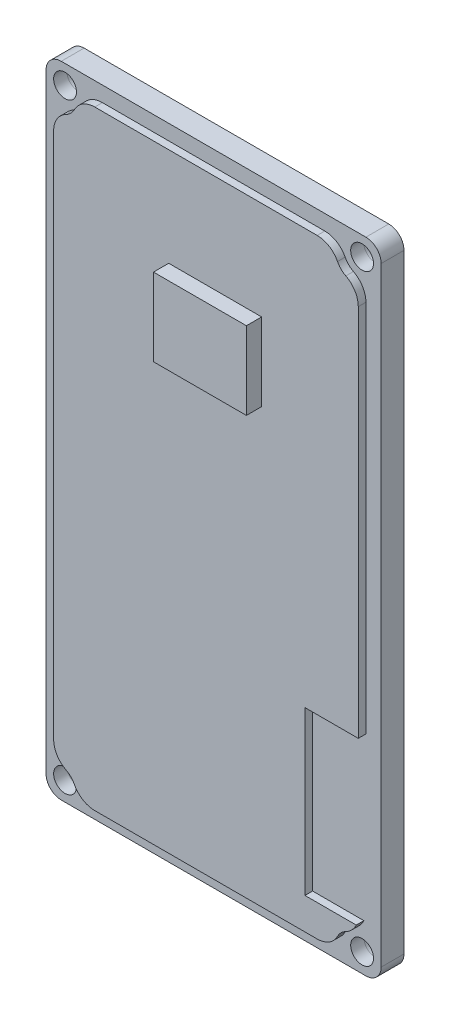
from build123d import *

# Parameters (mm, degrees)
BASESKETCH_R        = 1.5
BASE_DEPTH          = 3
REVERSESKIRT_DEPTH  = 1
BOSS_EXTRUDE3_START = 1
BASESKETCH_7_W      = 12.2
BASESKETCH_7_H      = 10.199864801
BOSS_EXTRUDE3_DEPTH = 2
TEXT_2_W            = 2.116666667
TEXT_2_H            = 4.396153846
CUT_EXTRUDE1_DEPTH  = 0.1
FILLET1_SIZE        = 0.254
FILLET1_SIZE_2      = 1.27


with BuildPart() as part:
    # baseSketch → base (new body)
    with BuildSketch(Plane.XY):
        with BuildLine():
            Line((-1.501668235, 82), (38.498331765, 82))
            ThreePointArc((38.498331765, 82), (39.912545328, 81.414213562), (40.498331765, 80))
            Line((40.498331765, 80), (40.498331765, 0))
            ThreePointArc((40.498331765, 0), (39.912545328, -1.414213562), (38.498331765, -2))
            Line((38.498331765, -2), (-1.501668235, -2))
            ThreePointArc((-1.501668235, -2), (-2.915881797, -1.414213562), (-3.501668235, 0))
            Line((-3.501668235, 0), (-3.501668235, 80))
            ThreePointArc((-3.501668235, 80), (-2.915881797, 81.414213562), (-1.501668235, 82))
        make_face()
        with Locations((-1.001668235, 0.5)):
            Circle(BASESKETCH_R, mode=Mode.SUBTRACT)
        with Locations((37.998331765, 0.5)):
            Circle(BASESKETCH_R, mode=Mode.SUBTRACT)
        with Locations((37.998331765, 79.5)):
            Circle(BASESKETCH_R, mode=Mode.SUBTRACT)
        with Locations((-1.001668235, 79.5)):
            Circle(BASESKETCH_R, mode=Mode.SUBTRACT)
    extrude(amount=-BASE_DEPTH)

    # baseSketch<6> → reverseSkirt (add)
    with BuildSketch(Plane.XY):
        with BuildLine():
            Line((33.09935228, 80), (3.897311251, 80))
            ThreePointArc((3.897311251, 80), (2.330612347, 79.558408596), (1.225140622, 78.363636364))
            ThreePointArc((1.225140622, 78.363636364), (0.766098718, 77.732233047), (0.134695402, 77.273191143))
            ThreePointArc((0.134695402, 77.273191143), (-1.060076831, 76.167719418), (-1.501668235, 74.601020514))
            Line((-1.501668235, 74.601020514), (-1.501668235, 5.398979486))
            ThreePointArc((-1.501668235, 5.398979486), (-1.060076831, 3.832280582), (0.134695402, 2.726808857))
            ThreePointArc((0.134695402, 2.726808857), (0.766098718, 2.267766953), (1.225140622, 1.636363636))
            ThreePointArc((1.225140622, 1.636363636), (2.330612347, 0.441591404), (3.897311251, 0))
            Line((3.897311251, 0), (33.09935228, 0))
            ThreePointArc((33.09935228, 0), (34.666051183, 0.441591404), (35.771522908, 1.636363636))
            ThreePointArc((35.771522908, 1.636363636), (36.230564812, 2.267766953), (36.861968129, 2.726808857))
            ThreePointArc((36.861968129, 2.726808857), (37.664536763, 3.323514259), (38.226374133, 4.150866975))
            Line((38.226374133, 4.150866975), (31.498331765, 4.150866975))
            Line((31.498331765, 4.150866975), (31.498331765, 25.512826935))
            Line((31.498331765, 25.512826935), (38.498331765, 25.512826935))
            Line((38.498331765, 25.512826935), (38.498331765, 74.601020514))
            ThreePointArc((38.498331765, 74.601020514), (38.056740362, 76.167719418), (36.861968129, 77.273191143))
            ThreePointArc((36.861968129, 77.273191143), (36.230564812, 77.732233047), (35.771522908, 78.363636364))
            ThreePointArc((35.771522908, 78.363636364), (34.666051183, 79.558408596), (33.09935228, 80))
        make_face()
    extrude(amount=REVERSESKIRT_DEPTH)

    # baseSketch<7> → Boss-Extrude3 (add)
    with BuildSketch(Plane.XY.offset(BOSS_EXTRUDE3_START)):
        with Locations((19.708331765, 61.985983146)):
            Rectangle(BASESKETCH_7_W, BASESKETCH_7_H)
    extrude(amount=BOSS_EXTRUDE3_DEPTH)

    # TEXT 2 → Cut-Extrude1 (cut)
    # profile 1 of 5: a face of its own
    with BuildSketch(Plane(origin=(0, 0, -3), x_dir=(-1, 0, 0), z_dir=(0, 0, -1))):
        with BuildLine():
            Line((-28.995166701, 69.796153846), (-27.397490419, 68.124699519))
            add(Edge.make_bspline(
                [(-27.397490419, 68.124699519), (-27.544123171, 67.982926351), (-27.830542873, 67.705998939), (-28.209317791, 67.259539174), (-28.52630191, 66.796423439), (-28.787908223, 66.32127296), (-28.993814832, 65.833157801), (-29.139413406, 65.330440941), (-29.229168764, 64.813856933), (-29.239359796, 64.464139608), (-29.244485612, 64.288241186)],
                knots=[0, 0, 0, 0, 1.115315123, 2.178559852, 3.196385012, 4.180486591, 5.141138664, 6.08807191, 7.038351522, 8, 8, 8, 8], degree=3))
            add(Edge.make_bspline(
                [(-29.244485612, 64.288241186), (-29.240424068, 64.141350187), (-29.232409059, 63.851476984), (-29.173509547, 63.425907377), (-29.073726161, 63.01867371), (-28.93502798, 62.629452891), (-28.760360462, 62.256320571), (-28.540815986, 61.902751274), (-28.283722113, 61.566844883), (-27.989528727, 61.252526184), (-27.665722403, 60.96876439), (-27.324696298, 60.713090982), (-26.960418487, 60.501318474), (-26.578201255, 60.328448816), (-26.177906583, 60.19222355), (-25.759554508, 60.095539013), (-25.322200465, 60.039519928), (-25.024879653, 60.031167849), (-24.873772471, 60.026923077)],
                knots=[0, 0, 0, 0, 1.035268443, 2.04298821, 3.02163646, 3.985902049, 4.951223231, 5.920091634, 6.913651787, 7.92868536, 8.949353712, 9.945284791, 10.92850487, 11.913014323, 12.897904816, 13.904240668, 14.934873455, 16, 16, 16, 16], degree=3))
            add(Edge.make_bspline(
                [(-24.873772471, 60.026923077), (-24.767718526, 60.028165395), (-24.558684024, 60.03061403), (-24.250249175, 60.056687234), (-23.950383133, 60.100107787), (-23.65980659, 60.160592915), (-23.378140132, 60.238129836), (-23.104724207, 60.327698343), (-22.84281875, 60.442100191), (-22.58751992, 60.567940714), (-22.344973285, 60.712716287), (-22.115019157, 60.871245981), (-21.897606066, 61.04206879), (-21.693507056, 61.227466073), (-21.505660271, 61.429772383), (-21.328950902, 61.644101715), (-21.166166353, 61.872583266), (-21.019898853, 62.115308609), (-20.883562036, 62.36493261), (-20.770662036, 62.626597822), (-20.669170392, 62.892984981), (-20.592818436, 63.168769386), (-20.526408286, 63.449092581), (-20.48584956, 63.737856549), (-20.455030286, 64.032320772), (-20.453132801, 64.231337924), (-20.452177919, 64.331490385)],
                knots=[0, 0, 0, 0, 1.103738238, 2.175490744, 3.219137561, 4.256155604, 5.262629953, 6.259184223, 7.247888397, 8.234817694, 9.220364322, 10.185094651, 11.140491148, 12.096499151, 13.05201798, 14.011605636, 14.986460005, 15.968997565, 16.960259839, 17.944382265, 18.933125845, 19.924977513, 20.920749559, 21.929466621, 22.958034467, 24, 24, 24, 24], degree=3))
            add(Edge.make_bspline(
                [(-20.452177919, 64.331490385), (-20.457073047, 64.50137174), (-20.466690699, 64.835144428), (-20.542448518, 65.324887019), (-20.665739365, 65.792315293), (-20.815538924, 66.16443902), (-20.960790839, 66.456155019), (-21.091365823, 66.680096629), (-21.241897985, 66.909212928), (-21.413012402, 67.143154987), (-21.603961383, 67.38328065), (-21.818476008, 67.625616162), (-22.04962254, 67.876287702), (-22.21459082, 68.040503195), (-22.299173112, 68.124699519)],
                knots=[0, 0, 0, 0, 1.404693586, 2.759857621, 4.088769373, 5.395275838, 6.0697462, 6.783214465, 7.53810233, 8.336454657, 9.18000028, 10.074808326, 11.012918585, 12, 12, 12, 12], degree=3))
            Line((-22.299173112, 68.124699519), (-20.597189938, 69.745272436))
            add(Edge.make_bspline(
                [(-20.597189938, 69.745272436), (-20.487206117, 69.631354883), (-20.272541219, 69.409012181), (-19.967737095, 69.073614388), (-19.693836705, 68.738638706), (-19.440898667, 68.41217745), (-19.21629168, 68.088882845), (-19.019791425, 67.768789174), (-18.846428127, 67.455520039), (-18.699125474, 67.142570305), (-18.574050222, 66.827992638), (-18.46636864, 66.504329186), (-18.375273896, 66.17059048), (-18.3017724, 65.824738196), (-18.242834124, 65.469998234), (-18.203051128, 65.103050699), (-18.176306344, 64.726222219), (-18.173903103, 64.470613623), (-18.17269074, 64.341666667)],
                knots=[0, 0, 0, 0, 1.244526981, 2.429050516, 3.560637417, 4.644440555, 5.67424972, 6.652764056, 7.595344123, 8.486817594, 9.369275933, 10.254498637, 11.166417451, 12.086725134, 13.032340136, 13.991389299, 14.986715468, 16, 16, 16, 16], degree=3))
            add(Edge.make_bspline(
                [(-18.17269074, 64.341666667), (-18.178728763, 64.10480708), (-18.190543496, 63.641338709), (-18.278082669, 62.962137895), (-18.42484055, 62.316915354), (-18.632396673, 61.70410138), (-18.897539892, 61.123890834), (-19.222593029, 60.57643215), (-19.606692469, 60.062607712), (-20.045336193, 59.586568209), (-20.529781362, 59.155967823), (-21.049942571, 58.775366947), (-21.608376222, 58.460533889), (-22.196832464, 58.199121216), (-22.817996654, 57.994699944), (-23.472540702, 57.850822024), (-24.159832604, 57.762093561), (-24.629268816, 57.752386541), (-24.868684329, 57.747435897)],
                knots=[0, 0, 0, 0, 1.078019885, 2.10938526, 3.111377082, 4.085535484, 5.04941344, 6.010039228, 6.978205633, 7.964457913, 8.951525778, 9.924444315, 10.892603023, 11.863865945, 12.85144698, 13.863884204, 14.910567087, 16, 16, 16, 16], degree=3))
            add(Edge.make_bspline(
                [(-24.868684329, 57.747435897), (-25.024832834, 57.749507179), (-25.334281005, 57.753611954), (-25.790894007, 57.797562387), (-26.235452271, 57.857258706), (-26.664156886, 57.955322006), (-27.081887637, 58.06932493), (-27.48494785, 58.216200785), (-27.875035367, 58.386841437), (-28.251657513, 58.581681383), (-28.610747266, 58.804841236), (-28.954594665, 59.047803005), (-29.278745529, 59.316459147), (-29.584536295, 59.60809052), (-29.875430567, 59.92000221), (-30.144274291, 60.257536113), (-30.398279908, 60.614935717), (-30.629871978, 60.994676792), (-30.840500982, 61.38810619), (-31.021710725, 61.79331219), (-31.177195323, 62.205071055), (-31.305206365, 62.624631294), (-31.401018497, 63.052734784), (-31.473474678, 63.486512958), (-31.513993445, 63.929606525), (-31.520625151, 64.227107272), (-31.523972791, 64.377283654)],
                knots=[0, 0, 0, 0, 1.071814294, 2.12407397, 3.147667899, 4.14936388, 5.141177959, 6.119239245, 7.091825145, 8.063277363, 9.028022524, 9.992609517, 10.952139039, 11.915934802, 12.892469547, 13.878248468, 14.87668965, 15.901326483, 16.93027266, 17.938917451, 18.9468897, 19.950817235, 20.948103127, 21.957084021, 22.968749718, 24, 24, 24, 24], degree=3))
            add(Edge.make_bspline(
                [(-31.523972791, 64.377283654), (-31.522051851, 64.505398785), (-31.518229942, 64.760297006), (-31.486426488, 65.139893695), (-31.436337673, 65.516412991), (-31.361292412, 65.888705125), (-31.270409147, 66.258444275), (-31.158465498, 66.624082439), (-31.021920484, 66.98461136), (-30.870872882, 67.343156538), (-30.69891303, 67.692567325), (-30.506437672, 68.029807102), (-30.298482145, 68.355711491), (-30.071469584, 68.66831583), (-29.828734506, 68.969821925), (-29.570284947, 69.259908075), (-29.291432697, 69.535790683), (-29.094421282, 69.708927377), (-28.995166701, 69.796153846)],
                knots=[0, 0, 0, 0, 0.996333415, 1.982307736, 2.96084097, 3.949129141, 4.93457382, 5.921430247, 6.92116383, 7.931890485, 8.946633814, 9.948019707, 10.950686436, 11.952094051, 12.951305284, 13.960287133, 14.972390273, 16, 16, 16, 16], degree=3))
        make_face()
    # profile 2 of 5: a face of its own
    with BuildSketch(Plane(origin=(0, 0, -3), x_dir=(-1, 0, 0), z_dir=(0, 0, -1))):
        with Locations((-23.138716381, 48.38525641)):
            Rectangle(TEXT_2_W, TEXT_2_H)
    # profile 3 of 5: a face of its own
    with BuildSketch(Plane(origin=(0, 0, -3), x_dir=(-1, 0, 0), z_dir=(0, 0, -1))):
        with BuildLine():
            Line((-29.501436733, 38.697435897), (-27.941921509, 36.992908654))
            add(Edge.make_bspline(
                [(-27.941921509, 36.992908654), (-28.044916247, 36.919894016), (-28.242651781, 36.779716092), (-28.507424321, 36.5525023), (-28.733295002, 36.326314494), (-28.91932024, 36.099057182), (-29.064369794, 35.868716043), (-29.167066481, 35.635690914), (-29.232351739, 35.40130288), (-29.240481324, 35.243830302), (-29.244485612, 35.166266026)],
                knots=[0, 0, 0, 0, 1.299362458, 2.494594718, 3.587462134, 4.587049575, 5.512617175, 6.380583204, 7.202344345, 8, 8, 8, 8], degree=3))
            add(Edge.make_bspline(
                [(-29.244485612, 35.166266026), (-29.242023752, 35.093880583), (-29.237270549, 34.954123311), (-29.187646557, 34.755816969), (-29.107456856, 34.577605219), (-28.996687579, 34.424235141), (-28.864396918, 34.300852249), (-28.723567053, 34.204914682), (-28.570016129, 34.149165174), (-28.464708217, 34.142005836), (-28.412574554, 34.138461538)],
                knots=[0, 0, 0, 0, 1.184157716, 2.286297433, 3.324836695, 4.370048774, 5.362957217, 6.276446515, 7.146738784, 8, 8, 8, 8], degree=3))
            add(Edge.make_bspline(
                [(-28.412574554, 34.138461538), (-28.35971357, 34.140705074), (-28.253258896, 34.145223242), (-28.097236313, 34.188862597), (-27.944784086, 34.254639565), (-27.851979162, 34.317492144), (-27.804541701, 34.349619391)],
                knots=[0, 0, 0, 0, 0.967525499, 1.948461899, 2.951351359, 4, 4, 4, 4], degree=3))
            add(Edge.make_bspline(
                [(-27.804541701, 34.349619391), (-27.767774299, 34.378940023), (-27.682651567, 34.446822225), (-27.545798515, 34.572445063), (-27.384041359, 34.736478507), (-27.194019144, 34.934846153), (-26.973927719, 35.166856004), (-26.727443534, 35.436105012), (-26.456963851, 35.744560419), (-26.266277043, 35.960909121), (-26.166160291, 36.074499199)],
                knots=[0, 0, 0, 0, 0.473854981, 1.097054127, 1.870604305, 2.795416232, 3.865517794, 5.093525133, 6.47400653, 8, 8, 8, 8], degree=3))
            add(Edge.make_bspline(
                [(-26.166160291, 36.074499199), (-26.073730002, 36.181354138), (-25.898316517, 36.384142613), (-25.648935813, 36.672304664), (-25.425581046, 36.927199975), (-25.226579666, 37.146510374), (-25.060126805, 37.336789372), (-24.915982054, 37.489621371), (-24.80045112, 37.611547259), (-24.730590406, 37.680786877), (-24.700775676, 37.710336538)],
                knots=[0, 0, 0, 0, 1.543627419, 2.929484142, 4.163674036, 5.24627963, 6.164986907, 6.925413438, 7.541394495, 8, 8, 8, 8], degree=3))
            add(Edge.make_bspline(
                [(-24.700775676, 37.710336538), (-24.5794307, 37.822446946), (-24.346163043, 38.03796252), (-23.984763056, 38.318228386), (-23.632274262, 38.547881695), (-23.282936132, 38.727617493), (-22.928682814, 38.862112978), (-22.5618743, 38.956338508), (-22.179725527, 39.013628705), (-21.9194567, 39.019903291), (-21.787814938, 39.023076923)],
                knots=[0, 0, 0, 0, 1.206593015, 2.319495511, 3.336910718, 4.276265636, 5.184178927, 6.099356736, 7.038670786, 8, 8, 8, 8], degree=3))
            add(Edge.make_bspline(
                [(-21.787814938, 39.023076923), (-21.659550667, 39.020803604), (-21.407891393, 39.016343267), (-21.03962552, 38.961712705), (-20.687179139, 38.883812712), (-20.354387168, 38.763365726), (-20.035787653, 38.616565411), (-19.736340667, 38.432530926), (-19.453025901, 38.216404268), (-19.190869033, 37.968702866), (-18.953094274, 37.694667331), (-18.740999694, 37.400916022), (-18.567279882, 37.083451331), (-18.418503688, 36.748596144), (-18.312631792, 36.390236939), (-18.229339059, 36.014905024), (-18.180541063, 35.618699233), (-18.175345217, 35.347875089), (-18.17269074, 35.209515224)],
                knots=[0, 0, 0, 0, 1.043169307, 2.046737005, 3.02462096, 3.976528701, 4.921503154, 5.875710796, 6.831116189, 7.817539083, 8.805892356, 9.780872653, 10.7604363, 11.74661763, 12.757588865, 13.796088471, 14.874055702, 16, 16, 16, 16], degree=3))
            add(Edge.make_bspline(
                [(-18.17269074, 35.209515224), (-18.174616267, 35.100896041), (-18.178429915, 34.885767764), (-18.209609286, 34.568711496), (-18.259820027, 34.262518409), (-18.332169208, 33.967716621), (-18.422590003, 33.681999688), (-18.538020608, 33.408152723), (-18.670719273, 33.144207705), (-18.8235373, 32.890707203), (-19.00112398, 32.649249781), (-19.196527402, 32.413068688), (-19.419213853, 32.189943683), (-19.664859877, 31.974874375), (-19.934972033, 31.770636082), (-20.22545156, 31.570255796), (-20.541785568, 31.382719584), (-20.76369254, 31.266867156), (-20.877037695, 31.207692308)],
                knots=[0, 0, 0, 0, 1.016956594, 2.014157282, 2.980233409, 3.920138626, 4.854357287, 5.783465618, 6.699725051, 7.61900777, 8.551402113, 9.504102091, 10.486778735, 11.499758944, 12.559144124, 13.656050795, 14.802762778, 16, 16, 16, 16], degree=3))
            Line((-20.877037695, 31.207692308), (-22.080383047, 33.212419872))
            add(Edge.make_bspline(
                [(-22.080383047, 33.212419872), (-21.951721112, 33.286438413), (-21.705065185, 33.428338283), (-21.373651685, 33.668800879), (-21.089850882, 33.915142532), (-20.858678972, 34.173058441), (-20.67704489, 34.439412445), (-20.547236574, 34.715491096), (-20.466885373, 35.001488361), (-20.457072636, 35.196296705), (-20.452177919, 35.293469551)],
                knots=[0, 0, 0, 0, 1.283663364, 2.460892379, 3.537111102, 4.529833553, 5.449777664, 6.316464042, 7.160231139, 8, 8, 8, 8], degree=3))
            add(Edge.make_bspline(
                [(-20.452177919, 35.293469551), (-20.45617521, 35.392308248), (-20.463930537, 35.584069715), (-20.535564151, 35.85778467), (-20.64803418, 36.108736905), (-20.808513401, 36.325658164), (-20.993730815, 36.509333409), (-21.199793656, 36.644896282), (-21.422748675, 36.730057794), (-21.577627898, 36.73906143), (-21.655523272, 36.743589744)],
                knots=[0, 0, 0, 0, 1.13588714, 2.203786484, 3.234766741, 4.283437687, 5.291419208, 6.222934724, 7.106237994, 8, 8, 8, 8], degree=3))
            add(Edge.make_bspline(
                [(-21.655523272, 36.743589744), (-21.727992242, 36.739408032), (-21.875206016, 36.730913284), (-22.094089226, 36.668343592), (-22.312872892, 36.57052808), (-22.492325174, 36.45480543), (-22.642575706, 36.337043144), (-22.772760995, 36.224435837), (-22.916592948, 36.087309925), (-23.074252494, 35.9260131), (-23.247127552, 35.742676513), (-23.435201191, 35.537145726), (-23.636816709, 35.307067195), (-23.774155207, 35.144447235), (-23.845967983, 35.059415064)],
                knots=[0, 0, 0, 0, 0.916159276, 1.861089862, 2.860218735, 3.940849679, 4.552606315, 5.27541173, 6.11797699, 7.06649574, 8.129236253, 9.306560635, 10.591630461, 12, 12, 12, 12], degree=3))
            add(Edge.make_bspline(
                [(-23.845967983, 35.059415064), (-23.982738901, 34.897765386), (-24.245243689, 34.587510727), (-24.632956534, 34.149083684), (-24.995304311, 33.754014094), (-25.336789865, 33.405747164), (-25.651031859, 33.099739099), (-25.940820009, 32.838396453), (-26.208195277, 32.623119805), (-26.527006339, 32.399664119), (-26.912045115, 32.184777129), (-27.374997987, 31.998705087), (-27.838358202, 31.879119581), (-28.149860414, 31.865619165), (-28.303179522, 31.858974359)],
                knots=[0, 0, 0, 0, 1.345561566, 2.582539916, 3.71901348, 4.751744315, 5.681651107, 6.506005906, 7.230637833, 7.861516384, 8.978504332, 10.023243174, 11.027054763, 12, 12, 12, 12], degree=3))
            add(Edge.make_bspline(
                [(-28.303179522, 31.858974359), (-28.41191006, 31.861729204), (-28.6261209, 31.867156543), (-28.941087569, 31.915567553), (-29.245000672, 31.987923627), (-29.536766838, 32.092990852), (-29.815963035, 32.229408173), (-30.084174882, 32.394884072), (-30.338586773, 32.593292896), (-30.581701258, 32.814044101), (-30.801596457, 33.060195987), (-30.995576073, 33.322140731), (-31.160298409, 33.598729502), (-31.292525891, 33.891027973), (-31.397488362, 34.196648698), (-31.471018781, 34.516363798), (-31.514981977, 34.849572647), (-31.520938515, 35.076241194), (-31.523972791, 35.191706731)],
                knots=[0, 0, 0, 0, 1.010608097, 1.99100651, 2.956992389, 3.912457524, 4.868345712, 5.842283282, 6.837666818, 7.864758285, 8.892394644, 9.901925088, 10.892014243, 11.880216914, 12.880338321, 13.892361018, 14.926363314, 16, 16, 16, 16], degree=3))
            add(Edge.make_bspline(
                [(-31.523972791, 35.191706731), (-31.518498975, 35.341341452), (-31.50759455, 35.63942973), (-31.422321366, 36.080159733), (-31.288231283, 36.510654879), (-31.126431971, 36.857528734), (-30.969775192, 37.133594155), (-30.825312572, 37.344977197), (-30.660453045, 37.561328012), (-30.470550141, 37.779297757), (-30.261832768, 38.004177603), (-30.029489826, 38.23264519), (-29.775911505, 38.46713422), (-29.594531114, 38.619323829), (-29.501436733, 38.697435897)],
                knots=[0, 0, 0, 0, 1.282949271, 2.555771389, 3.837399776, 5.142782039, 5.830402679, 6.558840402, 7.337330299, 8.162747002, 9.037840561, 9.968992266, 10.957575255, 12, 12, 12, 12], degree=3))
        make_face()
    # profile 4 of 5: a face of its own
    with BuildSketch(Plane(origin=(0, 0, -3), x_dir=(-1, 0, 0), z_dir=(0, 0, -1))):
        with BuildLine():
            Line((-31.198331765, 21.926923077), (-31.198331765, 24.582932692))
            add(Edge.make_bspline(
                [(-31.198331765, 24.582932692), (-31.197717808, 24.758495419), (-31.196536996, 25.096151996), (-31.177506599, 25.58301353), (-31.15160169, 26.030336371), (-31.110125926, 26.438343245), (-31.06122899, 26.808025171), (-30.997491071, 27.138197357), (-30.926191781, 27.429899711), (-30.836989455, 27.685236395), (-30.736529992, 27.915741237), (-30.620759687, 28.130357906), (-30.492175307, 28.335423364), (-30.342452162, 28.524329103), (-30.184949366, 28.708119343), (-30.009044742, 28.877746251), (-29.817793881, 29.036124246), (-29.611234993, 29.180394128), (-29.393733565, 29.313063388), (-29.164502916, 29.427185599), (-28.925407662, 29.524486336), (-28.677626512, 29.606243166), (-28.418687919, 29.667201276), (-28.151544756, 29.70894195), (-27.874785593, 29.739653292), (-27.686755804, 29.741411044), (-27.590839778, 29.742307692)],
                knots=[0, 0, 0, 0, 1.748890285, 3.363608654, 4.853419723, 6.211897754, 7.448506646, 8.566916444, 9.560702549, 10.437053547, 11.257979428, 12.063058964, 12.86458444, 13.665575447, 14.461919362, 15.274455744, 16.096554533, 16.933325211, 17.78237398, 18.632472903, 19.481227396, 20.352186419, 21.229229428, 22.127857616, 23.044999956, 24, 24, 24, 24], degree=3))
            add(Edge.make_bspline(
                [(-27.590839778, 29.742307692), (-27.490728786, 29.739962704), (-27.294429375, 29.735364609), (-27.006043658, 29.710802107), (-26.729467408, 29.665137527), (-26.466475531, 29.598225766), (-26.21437453, 29.518136318), (-25.977099055, 29.414412763), (-25.750451732, 29.296463116), (-25.538167499, 29.156536577), (-25.335684302, 29.002877327), (-25.150356255, 28.82442032), (-24.973398058, 28.63124909), (-24.81083576, 28.417485311), (-24.663681339, 28.183768973), (-24.525957595, 27.934494877), (-24.400110733, 27.666218058), (-24.329720177, 27.477774884), (-24.293724394, 27.381410256)],
                knots=[0, 0, 0, 0, 1.099808295, 2.156523617, 3.176426857, 4.17500812, 5.135317955, 6.078349783, 7.015890908, 7.9382699, 8.868004242, 9.803692517, 10.759882289, 11.743580734, 12.748787378, 13.791075452, 14.870417076, 16, 16, 16, 16], degree=3))
            Line((-24.293724394, 27.381410256), (-18.498331765, 30.312179487))
            Line((-18.498331765, 30.312179487), (-18.498331765, 27.778285256))
            Line((-18.498331765, 27.778285256), (-24.034229201, 24.979807692))
            Line((-24.034229201, 24.979807692), (-24.034229201, 24.206410256))
            Line((-24.034229201, 24.206410256), (-18.498331765, 24.206410256))
            Line((-18.498331765, 24.206410256), (-18.498331765, 21.926923077))
            Line((-18.498331765, 21.926923077), (-31.198331765, 21.926923077))
        make_face()
        with BuildLine():
            Line((-26.313716381, 24.206410256), (-26.313716381, 25.094290865))
            add(Edge.make_bspline(
                [(-26.313716381, 25.094290865), (-26.314938953, 25.20284165), (-26.317279915, 25.410693079), (-26.32813827, 25.709610733), (-26.354301538, 25.98109925), (-26.38735785, 26.226324495), (-26.425526136, 26.446520418), (-26.480223607, 26.63972295), (-26.538833332, 26.808909046), (-26.611670016, 26.952073846), (-26.694501124, 27.07439056), (-26.788599322, 27.180003215), (-26.897506004, 27.267360023), (-27.018261557, 27.339259132), (-27.151934033, 27.395188822), (-27.297056012, 27.436013211), (-27.45528062, 27.458828007), (-27.564477144, 27.461452927), (-27.621368624, 27.462820513)],
                knots=[0, 0, 0, 0, 1.688639943, 3.233382647, 4.650958383, 5.928841754, 7.082724185, 8.122798841, 9.049171256, 9.863274652, 10.613301712, 11.341792392, 12.054588806, 12.776240173, 13.521029143, 14.301969904, 15.115324896, 16, 16, 16, 16], degree=3))
            add(Edge.make_bspline(
                [(-27.621368624, 27.462820513), (-27.688713021, 27.460361395), (-27.82017565, 27.455560965), (-28.009969167, 27.403657701), (-28.186903608, 27.325335995), (-28.34857754, 27.21447908), (-28.489886946, 27.076095104), (-28.614719886, 26.917243048), (-28.712330006, 26.733787558), (-28.780874094, 26.565591403), (-28.819349853, 26.411120165), (-28.848242024, 26.272191256), (-28.869711039, 26.111452089), (-28.887089837, 25.928088157), (-28.902602692, 25.723719124), (-28.912474367, 25.496342814), (-28.91682243, 25.24695206), (-28.918151126, 25.073091406), (-28.918844586, 24.982351763)],
                knots=[0, 0, 0, 0, 1.020140795, 1.991411262, 2.965409065, 3.947543434, 4.949233831, 5.95883764, 7.001880521, 8.094604842, 8.706727239, 9.41631554, 10.248493651, 11.167128553, 12.212949395, 13.360078347, 14.622198054, 16, 16, 16, 16], degree=3))
            Line((-28.918844586, 24.982351763), (-28.918844586, 24.206410256))
            Line((-28.918844586, 24.206410256), (-26.313716381, 24.206410256))
        make_face(mode=Mode.SUBTRACT)
    # profile 5 of 5: a face of its own
    with BuildSketch(Plane(origin=(0, 0, -3), x_dir=(-1, 0, 0), z_dir=(0, 0, -1))):
        with BuildLine():
            Line((-31.198331765, 9.552564103), (-31.198331765, 12.424819712))
            add(Edge.make_bspline(
                [(-31.198331765, 12.424819712), (-31.196802663, 12.648750562), (-31.193846891, 13.081611427), (-31.159266434, 13.708651958), (-31.108492128, 14.292157935), (-31.030765413, 14.830800224), (-30.940609583, 15.326549054), (-30.819671407, 15.775643988), (-30.68177048, 16.18134149), (-30.51908018, 16.547581735), (-30.32950003, 16.881938961), (-30.118298354, 17.199417854), (-29.877766992, 17.499400281), (-29.612538635, 17.786094615), (-29.317763106, 18.055801386), (-28.998322385, 18.313012075), (-28.649584299, 18.551429023), (-28.279910443, 18.778259052), (-27.887734188, 18.983396631), (-27.476393653, 19.162325293), (-27.048535968, 19.312214917), (-26.603705148, 19.434007999), (-26.143377896, 19.531091142), (-25.666625315, 19.59901826), (-25.173888797, 19.641011481), (-24.839937066, 19.645271343), (-24.670246829, 19.647435897)],
                knots=[0, 0, 0, 0, 1.443572968, 2.79044287, 4.047742841, 5.218390556, 6.298195001, 7.294187071, 8.214052338, 9.058415274, 9.873579163, 10.689402867, 11.514245497, 12.34988967, 13.204999844, 14.087904451, 14.991805053, 15.926675376, 16.882870032, 17.842731001, 18.816259901, 19.80313118, 20.814314197, 21.847329874, 22.906167961, 24, 24, 24, 24], degree=3))
            add(Edge.make_bspline(
                [(-24.670246829, 19.647435897), (-24.43080286, 19.641767924), (-23.95944339, 19.630610187), (-23.267728799, 19.536623643), (-22.604651373, 19.384615577), (-21.975397959, 19.17087843), (-21.38557216, 18.905901583), (-20.845575277, 18.58935707), (-20.358305843, 18.22588616), (-19.926189688, 17.819723349), (-19.55478101, 17.379947837), (-19.236693081, 16.922932779), (-18.985866763, 16.444224288), (-18.82676706, 16.02241939), (-18.727911484, 15.656651834), (-18.669177213, 15.335545681), (-18.616766039, 14.970555115), (-18.569953158, 14.559259931), (-18.538753879, 14.101700603), (-18.51690651, 13.597799695), (-18.500756909, 13.048218352), (-18.499161328, 12.666519205), (-18.498331765, 12.46806891)],
                knots=[0, 0, 0, 0, 1.315448733, 2.589537832, 3.828572084, 5.048874227, 6.235690825, 7.376293813, 8.481764604, 9.569767924, 10.627792487, 11.639989165, 12.623927547, 13.589954798, 14.111118089, 14.704320463, 15.382530461, 16.137544902, 16.978618851, 17.902349489, 18.90940453, 20, 20, 20, 20], degree=3))
            Line((-18.498331765, 12.46806891), (-18.498331765, 9.552564103))
            Line((-18.498331765, 9.552564103), (-31.198331765, 9.552564103))
        make_face()
        with BuildLine():
            Line((-28.918844586, 11.832051282), (-20.777818945, 11.832051282))
            Line((-20.777818945, 11.832051282), (-20.777818945, 13.022676282))
            add(Edge.make_bspline(
                [(-20.777818945, 13.022676282), (-20.778504831, 13.164317811), (-20.779823818, 13.436700369), (-20.797946546, 13.830439589), (-20.827375704, 14.193807337), (-20.870905861, 14.527279574), (-20.923283782, 14.83162293), (-20.988068366, 15.105727244), (-21.066851354, 15.350132768), (-21.159697903, 15.566854977), (-21.265702834, 15.764717567), (-21.389483908, 15.94802126), (-21.527043941, 16.124931654), (-21.682304145, 16.292179105), (-21.85324251, 16.450386191), (-22.040730406, 16.59861973), (-22.244198396, 16.738857451), (-22.46472154, 16.867499937), (-22.699971269, 16.985054118), (-22.947668787, 17.089337852), (-23.209876899, 17.175804455), (-23.484141016, 17.247670202), (-23.772848919, 17.299026427), (-24.073862191, 17.341513908), (-24.388373418, 17.363417442), (-24.602377369, 17.366423566), (-24.710951958, 17.367948718)],
                knots=[0, 0, 0, 0, 1.502695833, 2.889746668, 4.180916226, 5.369476429, 6.456726991, 7.456222963, 8.355346258, 9.177624335, 9.954596642, 10.733182277, 11.52153258, 12.330160087, 13.151502329, 13.990398686, 14.863901178, 15.771270193, 16.696748626, 17.652564526, 18.61995629, 19.623816541, 20.657945923, 21.72937045, 22.847999446, 24, 24, 24, 24], degree=3))
            add(Edge.make_bspline(
                [(-24.710951958, 17.367948718), (-24.87733603, 17.364922026), (-25.201772079, 17.359020211), (-25.674257176, 17.301748596), (-26.118615795, 17.209467316), (-26.533706423, 17.075038996), (-26.922167975, 16.909727315), (-27.278994638, 16.699530057), (-27.610035184, 16.45721673), (-27.80419859, 16.265491175), (-27.901216381, 16.169691506)],
                knots=[0, 0, 0, 0, 1.138242922, 2.219485503, 3.251901297, 4.239342788, 5.201071, 6.134757343, 7.067992642, 8, 8, 8, 8], degree=3))
            add(Edge.make_bspline(
                [(-27.901216381, 16.169691506), (-27.983891459, 16.07523183), (-28.152745945, 15.882308638), (-28.3550768, 15.54359891), (-28.532844289, 15.170358332), (-28.673794082, 14.754048279), (-28.785263187, 14.298692202), (-28.862140704, 13.801577991), (-28.911541381, 13.265367801), (-28.916358029, 12.893893875), (-28.918844586, 12.702123397)],
                knots=[0, 0, 0, 0, 0.813307809, 1.661089106, 2.549956539, 3.493439533, 4.508053171, 5.589449661, 6.755572447, 8, 8, 8, 8], degree=3))
            Line((-28.918844586, 12.702123397), (-28.918844586, 11.832051282))
        make_face(mode=Mode.SUBTRACT)
    extrude(amount=-CUT_EXTRUDE1_DEPTH, mode=Mode.SUBTRACT)

    # Fillet1
    # an asymmetric fillet: 1.27, 0.254 mm, written as the material it takes off along each edge
    with BuildSketch(Plane(origin=(-1.001668235, 79.5, -3), x_dir=(1, 0, 0), z_dir=(0, -1, 0))) as fillet1_piece_1:
        with BuildLine():
            Bezier((1.5 + FILLET1_SIZE, 0), (1.5, 0), (1.5, FILLET1_SIZE_2), weights=[1, 0.707106781, 1])
            Line((1.5, FILLET1_SIZE_2), (1.5, 0))
            Line((1.5, 0), (1.5 + FILLET1_SIZE, 0))
        make_face()
    revolve(axis=Axis((-1.001668235, 79.5, -3), (0, 0, 1)), mode=Mode.SUBTRACT)
    with BuildSketch(Plane(origin=(37.998331765, 79.5, -3), x_dir=(1, 0, 0), z_dir=(0, -1, 0))) as fillet1_piece_2:
        with BuildLine():
            Bezier((1.5 + FILLET1_SIZE, 0), (1.5, 0), (1.5, FILLET1_SIZE_2), weights=[1, 0.707106781, 1])
            Line((1.5, FILLET1_SIZE_2), (1.5, 0))
            Line((1.5, 0), (1.5 + FILLET1_SIZE, 0))
        make_face()
    revolve(axis=Axis((37.998331765, 79.5, -3), (0, 0, 1)), mode=Mode.SUBTRACT)
    with BuildSketch(Plane(origin=(37.998331765, 0.5, -3), x_dir=(1, 0, 0), z_dir=(0, -1, 0))) as fillet1_piece_3:
        with BuildLine():
            Bezier((1.5 + FILLET1_SIZE, 0), (1.5, 0), (1.5, FILLET1_SIZE_2), weights=[1, 0.707106781, 1])
            Line((1.5, FILLET1_SIZE_2), (1.5, 0))
            Line((1.5, 0), (1.5 + FILLET1_SIZE, 0))
        make_face()
    revolve(axis=Axis((37.998331765, 0.5, -3), (0, 0, 1)), mode=Mode.SUBTRACT)
    with BuildSketch(Plane(origin=(-1.001668235, 0.5, -3), x_dir=(1, 0, 0), z_dir=(0, -1, 0))) as fillet1_piece_4:
        with BuildLine():
            Bezier((1.5 + FILLET1_SIZE, 0), (1.5, 0), (1.5, FILLET1_SIZE_2), weights=[1, 0.707106781, 1])
            Line((1.5, FILLET1_SIZE_2), (1.5, 0))
            Line((1.5, 0), (1.5 + FILLET1_SIZE, 0))
        make_face()
    revolve(axis=Axis((-1.001668235, 0.5, -3), (0, 0, 1)), mode=Mode.SUBTRACT)


solid = part.part
